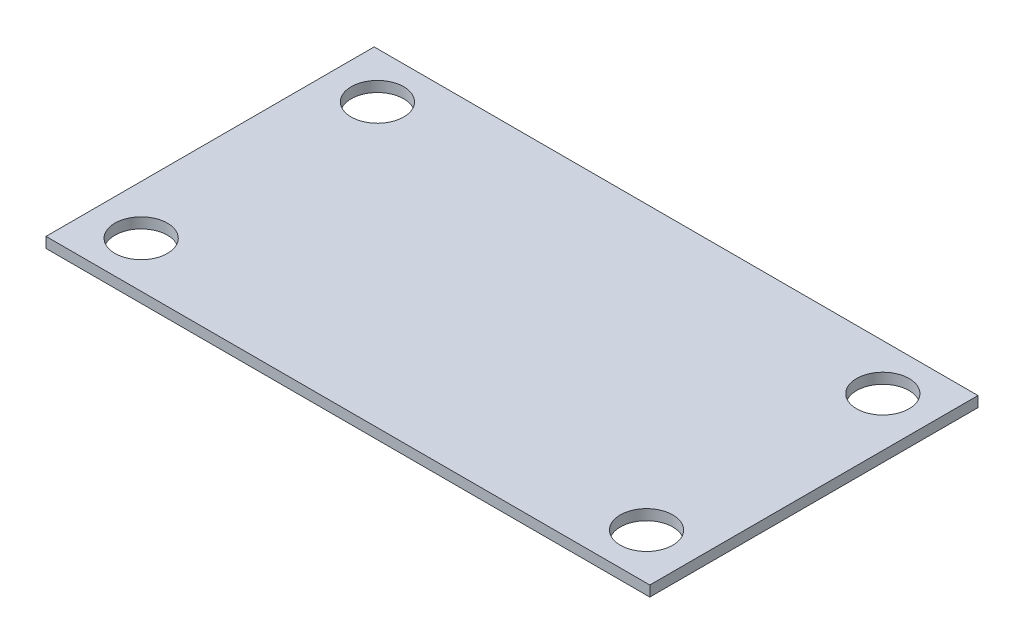
from build123d import *

# Parameters (mm, degrees)
SKETCH_1_W      = 92
SKETCH_1_H      = 50
SKETCH_1_R      = 4
EXTRUDE_1_DEPTH = 1.6


with BuildPart() as part:
    # 草图1 → 凸台-拉伸1 (new body)
    with BuildSketch(Plane(origin=(0, 0, 0), x_dir=(1, 0, 0), z_dir=(0, 1, 0))):
        Rectangle(SKETCH_1_W, SKETCH_1_H)
        with Locations((-38.5, -18)):
            Circle(SKETCH_1_R, mode=Mode.SUBTRACT)
        with Locations((38.5, -18)):
            Circle(SKETCH_1_R, mode=Mode.SUBTRACT)
        with Locations((38.5, 18)):
            Circle(SKETCH_1_R, mode=Mode.SUBTRACT)
        with Locations((-38.5, 18)):
            Circle(SKETCH_1_R, mode=Mode.SUBTRACT)
    extrude(amount=EXTRUDE_1_DEPTH)


solid = part.part
